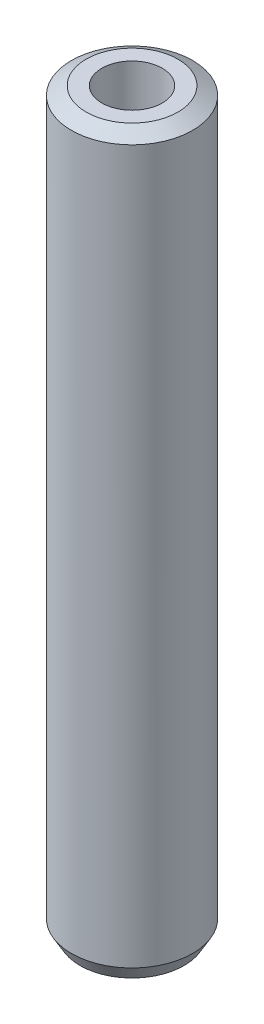
from build123d import *
from OCP.BRepFilletAPI import BRepFilletAPI_MakeChamfer

# Parameters (mm, degrees)
SKETCH1_R           = 17.5
BOSS_EXTRUDE1_DEPTH = 212.597942856
SKETCH2_R           = 8.721027974
CUT_EXTRUDE1_DEPTH  = 215.03360789
CHAMFER1_SIZE       = 2.449994361
CHAMFER1_SIZE2      = 4.243514711


with BuildPart() as part:
    # Sketch1 → Boss-Extrude1 (new body)
    with BuildSketch(Plane(origin=(0, 0, 0), x_dir=(1, 0, 0), z_dir=(0, 1, 0))):
        Circle(SKETCH1_R)
    extrude(amount=BOSS_EXTRUDE1_DEPTH)

    # Sketch2 → Cut-Extrude1 (cut, through all)
    with BuildSketch(Plane(origin=(0, 0, 0), x_dir=(1, 0, 0), z_dir=(0, 1, 0))):
        Circle(SKETCH2_R)
    extrude(amount=CUT_EXTRUDE1_DEPTH, mode=Mode.SUBTRACT)

    # Chamfer1: one chamfer whose edges measure the first distance from different faces: ONE call of the kernel's chamfer builder (chamfer() names one face for all edges)
    chamfer1_edges_1 = [part.edges().sort_by_distance(p)[0] for p in [
        (-17.5, 212.597942856, 0),
    ]]
    chamfer1_side_1 = [part.faces().sort_by_distance(p)[0] for p in [
        (-17.5, 106.298971428, 0),
    ]]
    chamfer1_edges_2 = [part.edges().sort_by_distance(p)[0] for p in [
        (-17.5, 0, 0),
    ]]
    chamfer1_side_2 = [part.faces().sort_by_distance(p)[0] for p in [
        (-17.005025253, 0, 0),
    ]]
    chamfer1 = BRepFilletAPI_MakeChamfer(part.part.solid().wrapped)
    for e in chamfer1_edges_1:
        chamfer1.Add(CHAMFER1_SIZE, CHAMFER1_SIZE2, e.wrapped, chamfer1_side_1[0].wrapped)  # the first distance lies on this face
    for e in chamfer1_edges_2:
        chamfer1.Add(CHAMFER1_SIZE, CHAMFER1_SIZE2, e.wrapped, chamfer1_side_2[0].wrapped)  # the first distance lies on this face
    add(Compound.cast(chamfer1.Shape()), mode=Mode.REPLACE)


solid = part.part
